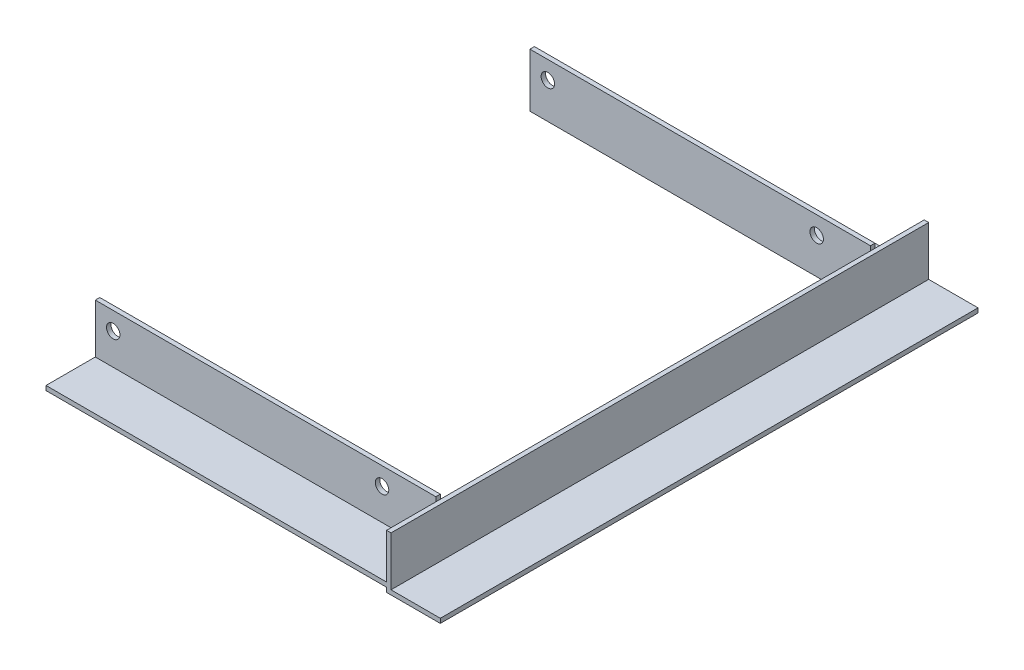
from build123d import *

# Parameters (mm, degrees)
EXTRUDE_THIN1_DEPTH     = 190.5
EXTRUDE_THIN2_DEPTH     = 241.3
CUT_EXTRUDE3_DEPTH      = 311.192787835
CUT_EXTRUDE3_DEPTH_BACK = 311.192787835
SKETCH5_R               = 4.7625


with BuildPart() as part:
    # Sketch1 → Extrude-Thin1 (new, symmetric)
    with BuildSketch(Plane.XY):
        Polygon((38.1, 0), (0, 0), (0, 38.1), (3.175, 38.1), (3.175, 3.175), (38.1, 3.175), align=None)
    extrude(amount=EXTRUDE_THIN1_DEPTH, both=True)

    # Sketch2 → Extrude-Thin2 (add)
    with BuildSketch(Plane.ZY):
        Polygon((-190.5, 3.175), (-152.4, 3.175), (-152.4, 41.275), (-155.575, 41.275), (-155.575, 6.35), (-190.5, 6.35), align=None)
        Polygon((190.5, 3.175), (152.4, 3.175), (152.4, 41.275), (155.575, 41.275), (155.575, 6.35), (190.5, 6.35), align=None)
    extrude(amount=EXTRUDE_THIN2_DEPTH)

    # Sketch5 → Cut-Extrude3 (cut, two sides: drawn at the far end of the back side and taken through both)
    with BuildSketch(Plane.XY.offset(-CUT_EXTRUDE3_DEPTH_BACK)):
        with Locations((-228.6, 28.575)):
            Circle(SKETCH5_R)
        with Locations((-38.1, 28.575)):
            Circle(SKETCH5_R)
    extrude(amount=CUT_EXTRUDE3_DEPTH + CUT_EXTRUDE3_DEPTH_BACK, mode=Mode.SUBTRACT)


solid = part.part
